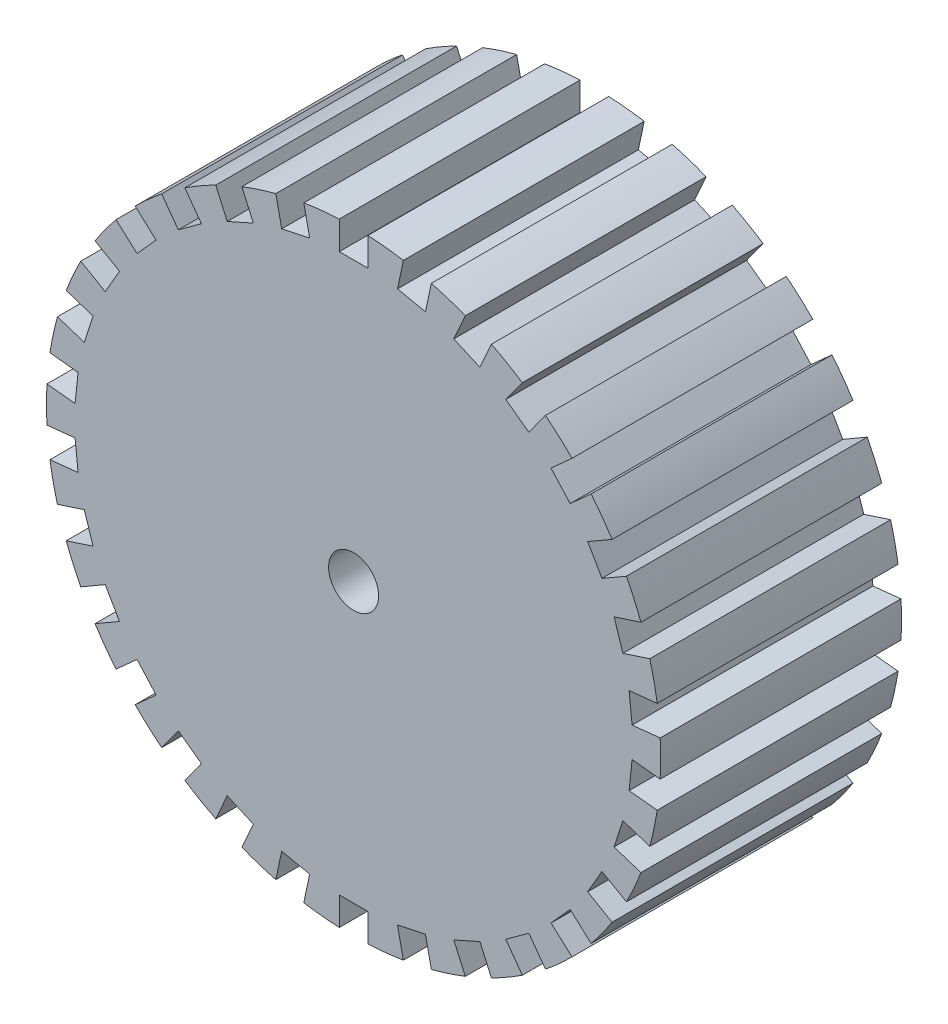
from build123d import *

# Parameters (mm, degrees)
SKETCH1_R             = 21.5
SKETCH1_R_2           = 1.75
BOSS_EXTRUDE1_DEPTH   = 16.86
CROQUIS1_W            = 2
CROQUIS1_H            = 3
CORTAR_EXTRUIR1_DEPTH = 35.767220194
MATRIZC2_COUNT        = 30


with BuildPart() as part:
    # Sketch1 → Boss-Extrude1 (new body)
    with BuildSketch(Plane.XY):
        Circle(SKETCH1_R)
        Circle(SKETCH1_R_2, mode=Mode.SUBTRACT)
    extrude(amount=BOSS_EXTRUDE1_DEPTH)

    # Croquis1 → Cortar-Extruir1 (cut, through all)
    with BuildSketch(Plane.XY.offset(16.86)):
        with Locations((0, 21)):
            Rectangle(CROQUIS1_W, CROQUIS1_H)
    cortar_extruir1 = extrude(amount=-CORTAR_EXTRUIR1_DEPTH, mode=Mode.SUBTRACT)

    # MatrizC2: Cortar-Extruir1 ×30 about axis
    matrizc2_axis = Axis((0, 0, 16.86), (0, 0, -1))
    for i in range(1, MATRIZC2_COUNT):
        add(cortar_extruir1.rotate(matrizc2_axis, i * 360 / MATRIZC2_COUNT), mode=Mode.SUBTRACT)


solid = part.part
